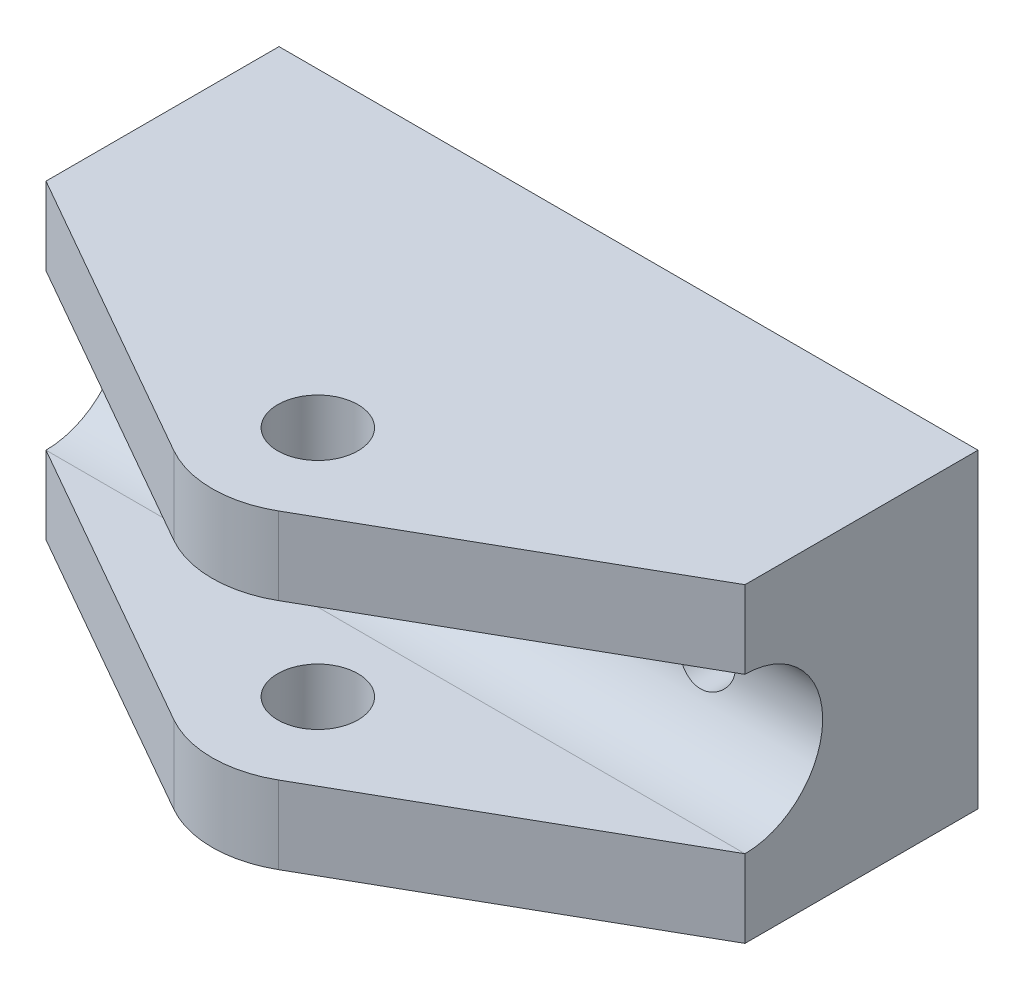
from build123d import *

# Parameters (mm, degrees)
SKETCH1_W           = 57.15
SKETCH1_H           = 25.4
SKETCH1_R           = 2.38125
BOSS_EXTRUDE1_DEPTH = 34.036
SKETCH2_R           = 3.281447176
CUT_EXTRUDE1_DEPTH  = 259.444021221
CUT_EXTRUDE2_DEPTH  = 263.565366711


with BuildPart() as part:
    # Sketch1 → Boss-Extrude1 (new body)
    with BuildSketch(Plane.XY):
        with Locations((226.355780427, 241.3)):
            Rectangle(SKETCH1_W, SKETCH1_H)
        with BuildLine():
            ThreePointArc((247.787030427, 241.3), (245.405780427, 238.91875), (243.024530427, 241.3))
            ThreePointArc((243.024530427, 241.3), (245.405780427, 243.68125), (247.787030427, 241.3))
        make_face(mode=Mode.SUBTRACT)
        with Locations((207.305780427, 241.3)):
            Circle(SKETCH1_R, mode=Mode.SUBTRACT)
    extrude(amount=BOSS_EXTRUDE1_DEPTH)

    # Sketch2 → Cut-Extrude1 (cut, through all)
    with BuildSketch(Plane(origin=(0, 254, 0), x_dir=(1, 0, 0), z_dir=(0, 1, 0))):
        with BuildLine():
            Line((254.930780427, -34.036), (254.930780427, -19.05))
            Line((254.930780427, -19.05), (230.6329732, -32.902407479))
            ThreePointArc((230.6329732, -32.902407479), (226.355780427, -34.036), (222.078587654, -32.902407479))
            Line((222.078587654, -32.902407479), (197.780780427, -19.05))
            Line((197.780780427, -19.05), (197.780780427, -34.036))
            Line((197.780780427, -34.036), (226.681841891, -42.314106695))
            Line((226.681841891, -42.314106695), (254.930780427, -34.036))
        make_face()
        with Locations((226.355780427, -25.4)):
            Circle(SKETCH2_R)
    extrude(amount=-CUT_EXTRUDE1_DEPTH, mode=Mode.SUBTRACT)

    # Sketch3 → Cut-Extrude2 (cut, through all)
    with BuildSketch(Plane.ZY.offset(-197.780780427)):
        with BuildLine():
            Line((19.05, 247.65), (49.022, 247.65))
            ThreePointArc((49.022, 247.65), (55.372, 241.3), (49.022, 234.95))
            Line((49.022, 234.95), (19.05, 234.95))
            ThreePointArc((19.05, 234.95), (12.7, 241.3), (19.05, 247.65))
        make_face()
    extrude(amount=-CUT_EXTRUDE2_DEPTH, mode=Mode.SUBTRACT)


solid = part.part
